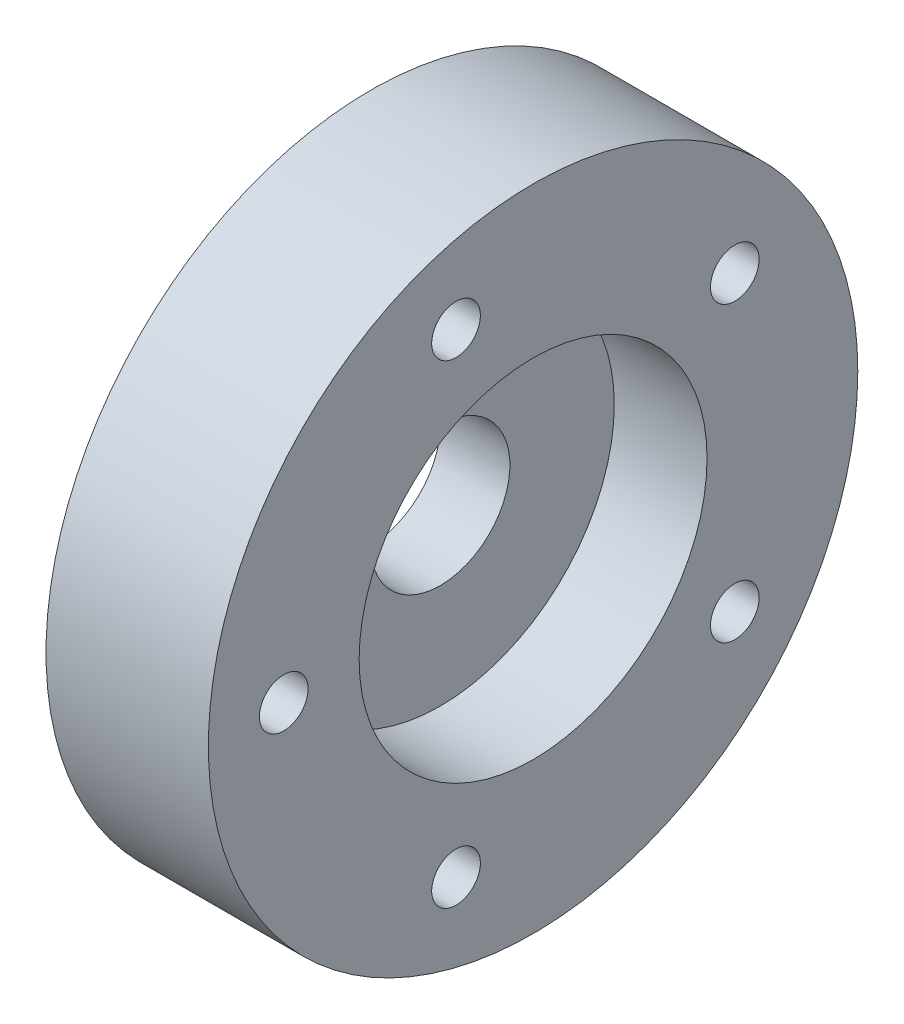
from build123d import *

# Parameters (mm, degrees)
SKETCH1_R                 = 28
BOSS_EXTRUDE1_DEPTH       = 14
SKETCH2_R                 = 15
CUT_EXTRUDE1_DEPTH        = 8
CUT_EXTRUDE2_DEPTH        = 16
M5X0_8_TAPPED_HOLE1_D     = 4.2
M5X0_8_TAPPED_HOLE1_DEPTH = 8
M5X0_8_TAPPED_HOLE1_TIP   = 1.2618073


with BuildPart() as part:
    # Sketch1 → Boss-Extrude1 (new body)
    with BuildSketch(Plane.YZ):
        Circle(SKETCH1_R)
    extrude(amount=BOSS_EXTRUDE1_DEPTH)

    # Sketch2 → Cut-Extrude1 (cut)
    with BuildSketch(Plane.YZ.offset(14)):
        Circle(SKETCH2_R)
    extrude(amount=-CUT_EXTRUDE1_DEPTH, mode=Mode.SUBTRACT)

    # Sketch3 → Cut-Extrude2 (cut)
    with BuildSketch(Plane(origin=(0, 0, 0), x_dir=(0, -1, 0), z_dir=(-1, 0, 0))):
        with BuildLine():
            Line((-2, 7.796854249), (2, 7.796854249))
            Line((2, 7.796854249), (2, 5.656854249))
            ThreePointArc((2, 5.656854249), (0, -6), (-2, 5.656854249))
            Line((-2, 5.656854249), (-2, 7.796854249))
        make_face()
    extrude(amount=-CUT_EXTRUDE2_DEPTH, mode=Mode.SUBTRACT)

    # M5x0.8 Tapped Hole1
    with Locations(Plane(origin=(14, -20.4477151, 6.643865379), x_dir=(0, 0, 1), z_dir=(1, 0, 0))):
        with Locations((0, 0), (14.856134621, -20.4477151), (-24.037730758, -7.810332176), (-24.037730758, -33.085098024), (0, -40.8954302)):
            Hole(M5X0_8_TAPPED_HOLE1_D / 2, depth=M5X0_8_TAPPED_HOLE1_DEPTH)
            with Locations((0, 0, -(M5X0_8_TAPPED_HOLE1_DEPTH + M5X0_8_TAPPED_HOLE1_TIP / 2))):  # 118° drill point
                Cone(0, M5X0_8_TAPPED_HOLE1_D / 2, M5X0_8_TAPPED_HOLE1_TIP, mode=Mode.SUBTRACT)


solid = part.part
